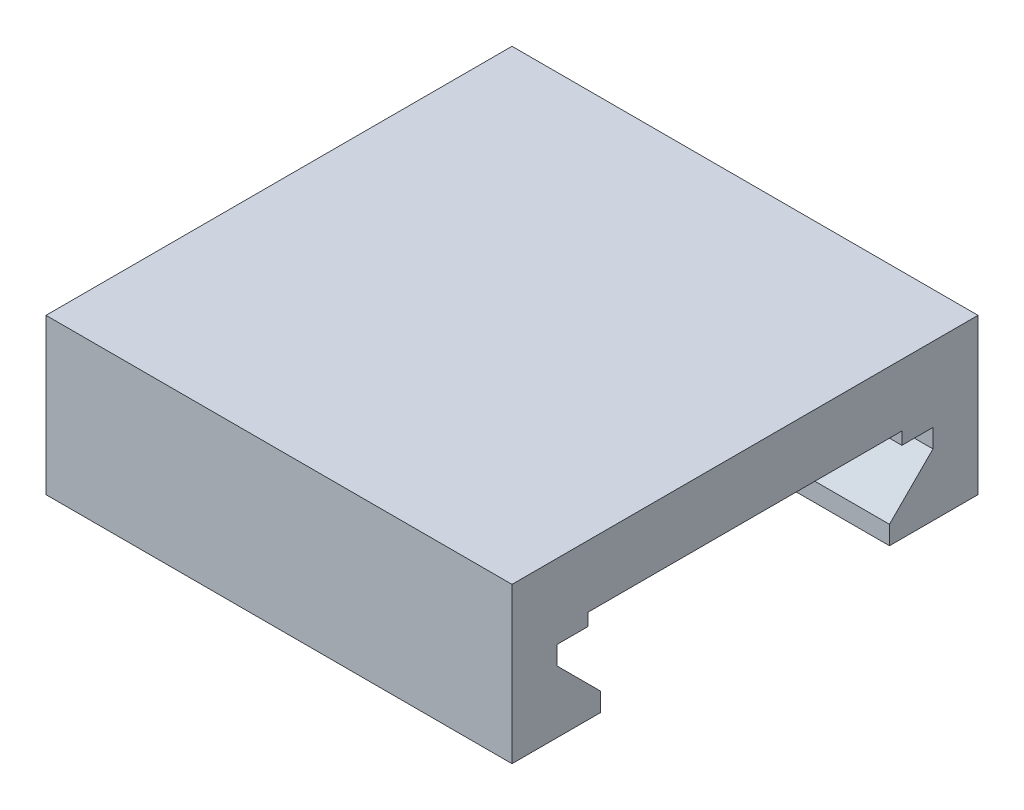
from build123d import *

# Parameters (mm, degrees)
BOSS_EXTRUDE1_DEPTH = 7.5


with BuildPart() as part:
    # LED Groove Profile Test → Boss-Extrude1 (new, symmetric)
    with BuildSketch(Plane(origin=(0, 0, 0), x_dir=(0, 0, -1), z_dir=(1, 0, 0))):
        Polygon((-4.65, 2.992304845), (-4.65, 2.392304845), (-7.5, 2.392304845), (-7.5, 7.392304845), (7.5, 7.392304845), (7.5, 2.392304845), (4.65, 2.392304845), (4.65, 2.992304845), (6.05, 4.392304845), (6.05, 4.992304845), (5.05, 4.992304845), (5.05, 5.392304845), (-5.05, 5.392304845), (-5.05, 4.992304845), (-6.05, 4.992304845), (-6.05, 4.392304845), align=None)
    extrude(amount=BOSS_EXTRUDE1_DEPTH, both=True)


solid = part.part
